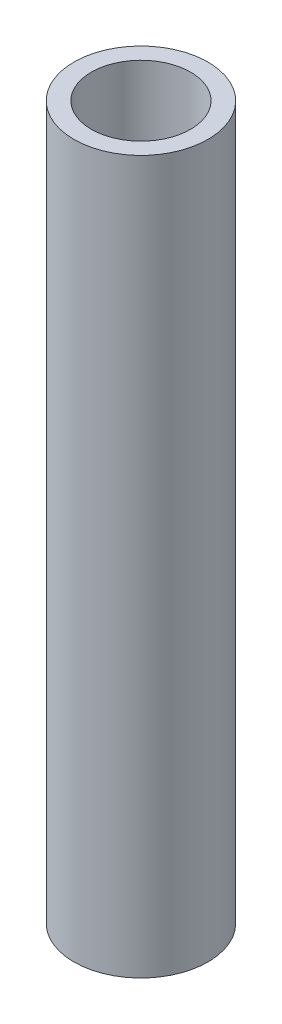
from build123d import *

# Parameters (mm, degrees)
SKETCH1_R           = 12.7
SKETCH1_R_2         = 9.398
BOSS_EXTRUDE1_DEPTH = 135


with BuildPart() as part:
    # Sketch1 → Boss-Extrude1 (new body)
    with BuildSketch(Plane(origin=(0, 0, 0), x_dir=(1, 0, 0), z_dir=(0, 1, 0))):
        Circle(SKETCH1_R)
        Circle(SKETCH1_R_2, mode=Mode.SUBTRACT)
    extrude(amount=BOSS_EXTRUDE1_DEPTH)


solid = part.part
